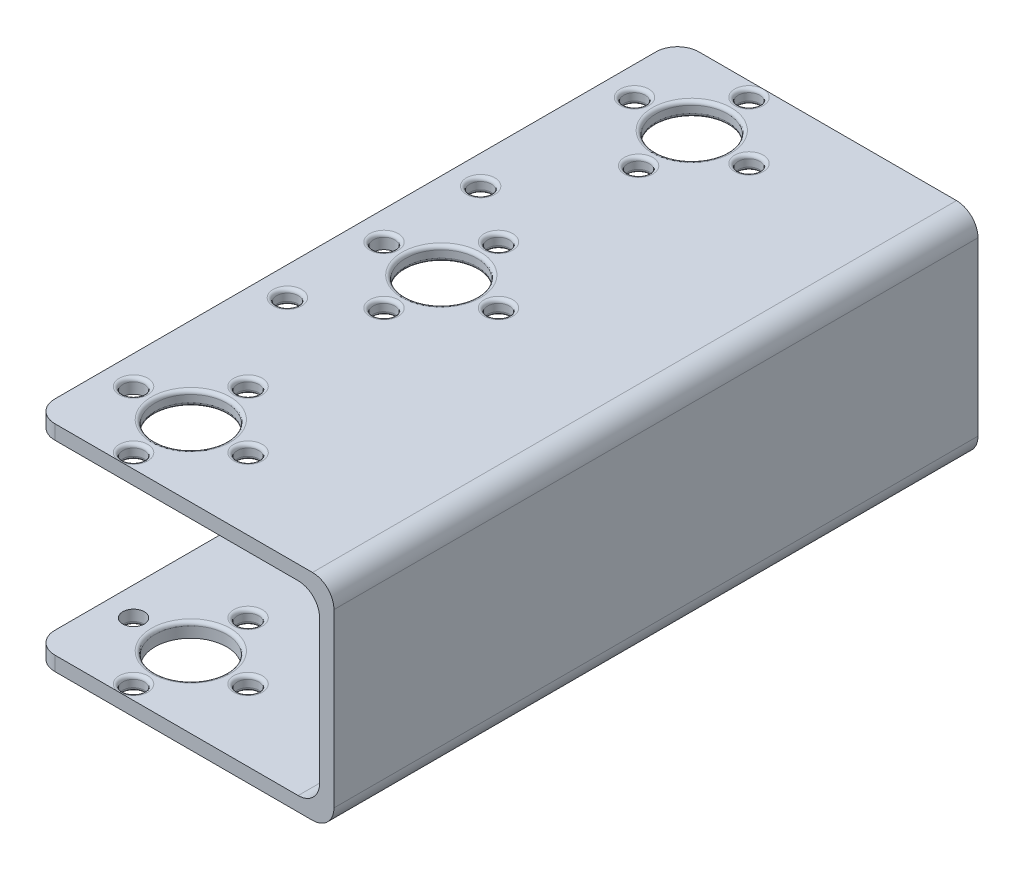
from build123d import *

# Parameters (mm, degrees)
BOSS_EXTRUDE1_DEPTH = 90
SKETCH2_R           = 5
SKETCH2_R_2         = 1.5
CUT_EXTRUDE1_DEPTH  = 104.749698795
FILLET1_R           = 3
FILLET2_R           = 0.5


with BuildPart() as part:
    # Sketch1 → Boss-Extrude1 (new body)
    with BuildSketch(Plane.XY):
        Polygon((0, 0), (42, 0), (42, 30), (0, 30), (0, 28), (40, 28), (40, 2), (0, 2), align=None)
    extrude(amount=BOSS_EXTRUDE1_DEPTH)

    # Sketch2 → Cut-Extrude1 (cut, through all)
    with BuildSketch(Plane(origin=(0, 30, 0), x_dir=(1, 0, 0), z_dir=(0, 1, 0))):
        with Locations(Location((12, -45, 0), (0, 0, 180))):
            Circle(SKETCH2_R)
        with Locations(Location((4, -45, 0), (0, 0, 180))):
            Circle(SKETCH2_R_2)
        with Locations(Location((12, -37, 0), (0, 0, 180))):
            Circle(SKETCH2_R_2)
        with Locations(Location((20, -45, 0), (0, 0, 180))):
            Circle(SKETCH2_R_2)
        with Locations(Location((12, -53, 0), (0, 0, 180))):
            Circle(SKETCH2_R_2)
        with Locations(Location((12, -10, 0), (0, 0, 180))):
            Circle(SKETCH2_R)
        with Locations(Location((4, -10, 0), (0, 0, 180))):
            Circle(SKETCH2_R_2)
        with Locations(Location((12, -2, 0), (0, 0, 180))):
            Circle(SKETCH2_R_2)
        with Locations(Location((20, -10, 0), (0, 0, 180))):
            Circle(SKETCH2_R_2)
        with Locations(Location((12.567277734, -18, 0), (0, 0, 180))):
            Circle(SKETCH2_R_2)
        with Locations(Location((12, -80, 0), (0, 0, 180))):
            Circle(SKETCH2_R)
        with Locations(Location((4, -80, 0), (0, 0, 180))):
            Circle(SKETCH2_R_2)
        with Locations(Location((12, -72, 0), (0, 0, 180))):
            Circle(SKETCH2_R_2)
        with Locations(Location((20, -80, 0), (0, 0, 180))):
            Circle(SKETCH2_R_2)
        with Locations(Location((12, -88, 0), (0, 0, 180))):
            Circle(SKETCH2_R_2)
        with Locations(Location((4, -31.5, 0), (0, 0, 180))):
            Circle(SKETCH2_R_2)
        with Locations(Location((4, -58.5, 0), (0, 0, 180))):
            Circle(SKETCH2_R_2)
    extrude(amount=-CUT_EXTRUDE1_DEPTH, mode=Mode.SUBTRACT)

    # Fillet1
    fillet1_edges = [part.edges().sort_by_distance(p)[0] for p in [
        (0, 1, 0),
        (40, 2, 45),
        (40, 28, 45),
        (42, 30, 45),
        (42, 0, 45),
        (0, 29, 90),
        (0, 1, 90),
        (0, 29, 0),
    ]]
    fillet(fillet1_edges, radius=FILLET1_R)

    # Fillet2
    fillet2_edges = [part.edges().sort_by_distance(p)[0] for p in [
        (17, 28, 80),
        (17, 2, 80),
        (17, 30, 80),
        (5.5, 0, 80),
        (5.5, 30, 80),
        (13.5, 28, 72),
        (13.5, 0, 72),
        (13.5, 2, 72),
        (13.5, 30, 72),
        (17, 28, 45),
        (17, 0, 45),
        (17, 2, 45),
        (17, 30, 45),
        (13.5, 28, 53),
        (13.5, 0, 53),
        (13.5, 2, 53),
        (13.5, 30, 53),
        (5.5, 28, 10),
        (5.5, 0, 10),
        (5.5, 2, 10),
        (5.5, 30, 10),
        (13.5, 28, 2),
        (13.5, 0, 2),
        (13.5, 2, 2),
        (13.5, 30, 2),
        (21.5, 28, 10),
        (21.5, 0, 10),
        (21.5, 2, 10),
        (21.5, 30, 10),
        (5.5, 0, 45),
        (5.5, 2, 45),
        (5.5, 30, 45),
        (17, 28, 10),
        (17, 0, 10),
        (17, 2, 10),
        (17, 30, 10),
        (13.5, 28, 37),
        (13.5, 0, 37),
        (13.5, 2, 37),
        (13.5, 30, 37),
        (21.5, 28, 45),
        (21.5, 0, 45),
        (21.5, 2, 45),
        (21.5, 30, 45),
        (5.5, 28, 58.5),
        (5.5, 0, 58.5),
        (5.5, 30, 58.5),
        (5.5, 28, 31.5),
        (5.5, 0, 31.5),
        (5.5, 2, 31.5),
        (5.5, 30, 31.5),
        (13.5, 28, 88),
        (13.5, 0, 88),
        (13.5, 2, 88),
        (13.5, 30, 88),
        (21.5, 28, 80),
        (21.5, 0, 80),
        (21.5, 2, 80),
        (21.5, 30, 80),
        (14.067277734, 28, 18),
        (14.067277734, 0, 18),
        (14.067277734, 2, 18),
        (14.067277734, 30, 18),
    ]]
    fillet(fillet2_edges, radius=FILLET2_R - 0.0001)  # a hair under: the kernel refuses the full size


solid = part.part
